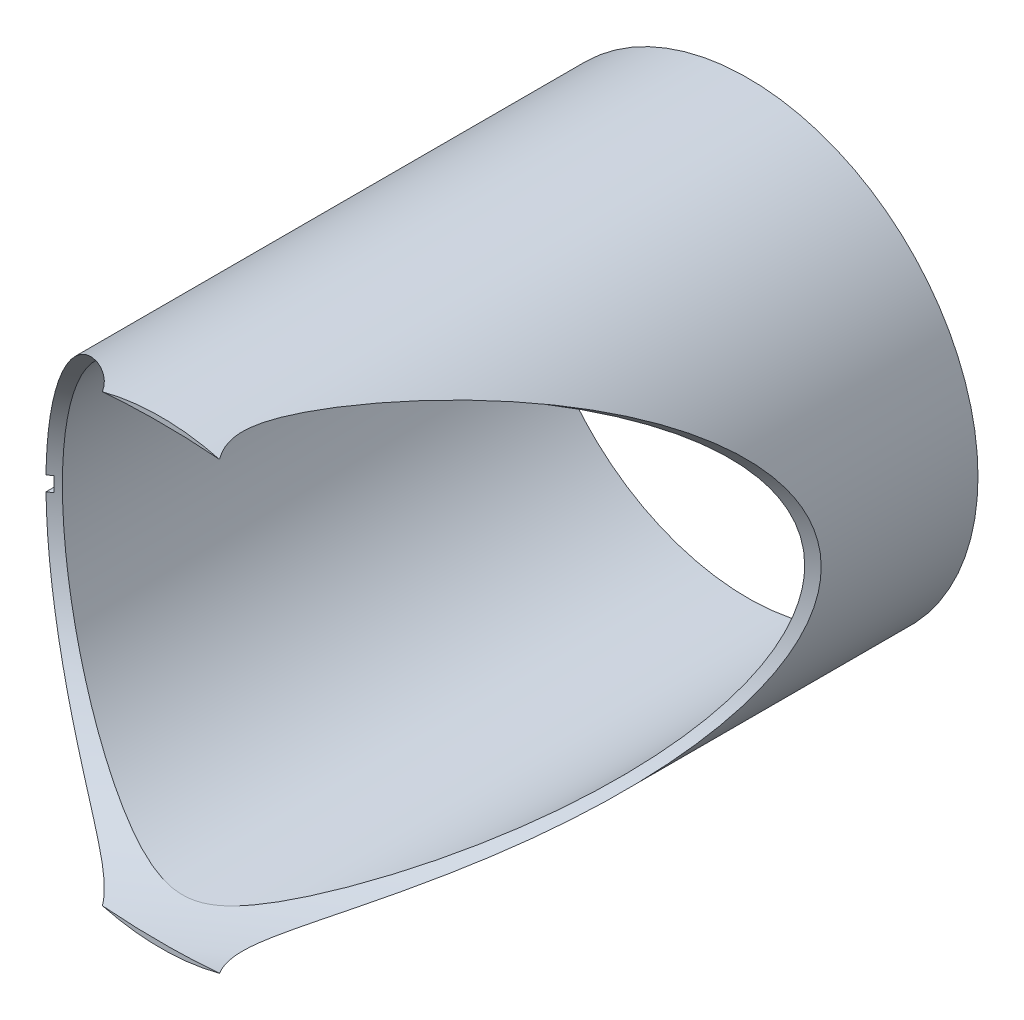
from build123d import *

# Parameters (mm, degrees)
SKETCH1_R           = 23.525
SKETCH1_R_2         = 22.525
BOSS_EXTRUDE1_DEPTH = 60
SKETCH2_R           = 23
CUT_EXTRUDE1_DEPTH  = 276.559355027
CUT_EXTRUDE2_DEPTH  = 472.081711225


with BuildPart() as part:
    # Sketch1 → Boss-Extrude1 (new body)
    with BuildSketch(Plane.XY):
        with Locations((443.127496957, 0)):
            Circle(SKETCH1_R)
        with Locations((443.127496957, 0)):
            Circle(SKETCH1_R_2, mode=Mode.SUBTRACT)
    extrude(amount=-BOSS_EXTRUDE1_DEPTH)

    # Sketch2 → Cut-Extrude1 (cut, through all)
    with BuildSketch(Plane(origin=(254.325020267, 0, -174.059113982), x_dir=(0.564788358012876, 0, 0.8252357909428794), z_dir=(-0.8252357909428792, 0, 0.5647883580128759))):
        with Locations((250.273251396, 0)):
            Circle(SKETCH2_R)
    extrude(amount=-CUT_EXTRUDE1_DEPTH, mode=Mode.SUBTRACT)

    # Sketch4 → Cut-Extrude2 (cut, through all)
    with BuildSketch(Plane(origin=(0, 0, -60), x_dir=(-1, 0, 0), z_dir=(0, 0, -1))):
        Polygon((-303.749390374, 0.75), (-419.614455363, 0.75), (-420.102496957, 0.75), (-420.102496957, -0.75), (-419.614455363, -0.75), (-303.749390374, -0.75), (-72.019260397, -0.75), (-72.019260397, 0.75), align=None)
    extrude(amount=-CUT_EXTRUDE2_DEPTH, mode=Mode.SUBTRACT)


solid = part.part
